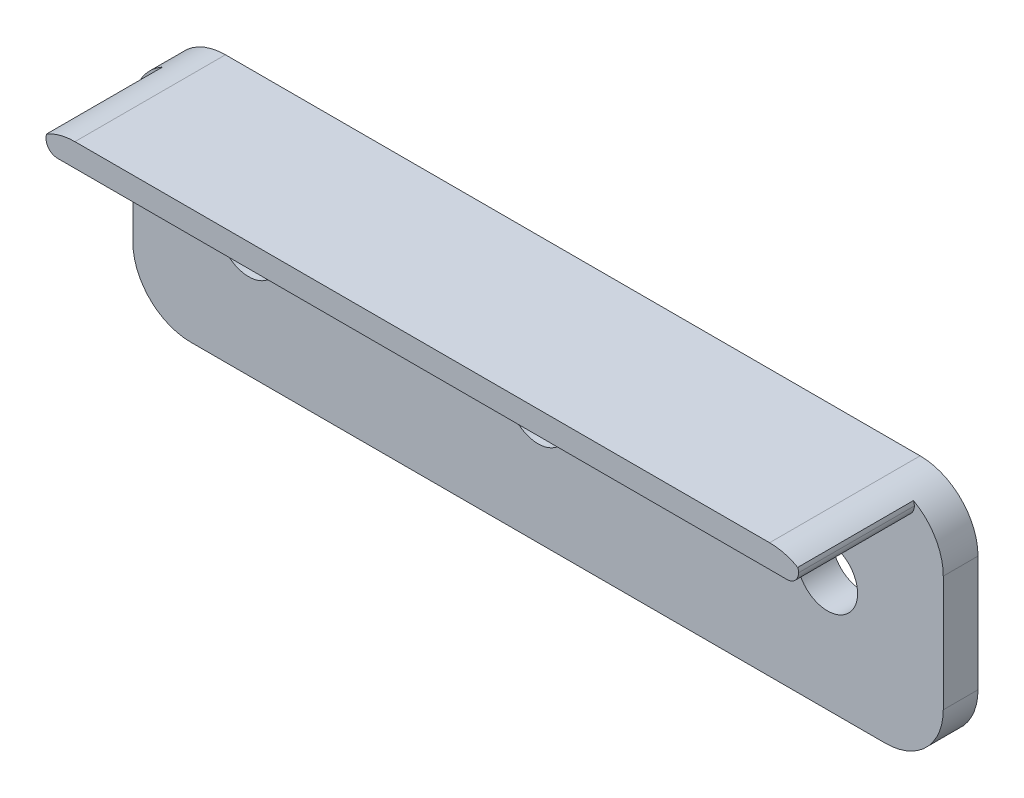
from build123d import *

# Parameters (mm, degrees)
SKETCH_2_W      = 70
SKETCH_2_H      = 20
SKETCH_2_R      = 2.6
EXTRUDE_1_DEPTH = 3
SKETCH_3_W      = 65
SKETCH_3_H      = 2
EXTRUDE_2_DEPTH = 10
FILLET_1_R      = 1
FILLET_2_R      = 5


with BuildPart() as part:
    # ｽｹｯﾁ2 → ﾎﾞｽ - 押し出し1 (new body)
    with BuildSketch(Plane.XY):
        Rectangle(SKETCH_2_W, SKETCH_2_H)
        with Locations((-25, 0)):
            Circle(SKETCH_2_R, mode=Mode.SUBTRACT)
        with Locations((25, 0)):
            Circle(SKETCH_2_R, mode=Mode.SUBTRACT)
        Circle(SKETCH_2_R, mode=Mode.SUBTRACT)
    extrude(amount=EXTRUDE_1_DEPTH)

    # ｽｹｯﾁ3 → ﾎﾞｽ - 押し出し2 (add)
    with BuildSketch(Plane.XY.offset(3)):
        with Locations((0, 9)):
            Rectangle(SKETCH_3_W, SKETCH_3_H)
    extrude(amount=EXTRUDE_2_DEPTH)

    # ﾌｨﾚｯﾄ1
    fillet_1_edges = [part.edges().sort_by_distance(p)[0] for p in [
        (-32.5, 10, 8),
        (-32.5, 8, 8),
        (32.5, 10, 8),
        (32.5, 8, 8),
    ]]
    fillet(fillet_1_edges, radius=FILLET_1_R - 0.0001)  # a hair under: the kernel refuses the full size

    # ﾌｨﾚｯﾄ2
    fillet_2_edges = [part.edges().sort_by_distance(p)[0] for p in [
        (-35, -10, 1.5),
        (-35, 10, 1.5),
        (35, -10, 1.5),
        (35, 10, 1.5),
    ]]
    fillet(fillet_2_edges, radius=FILLET_2_R)


solid = part.part
